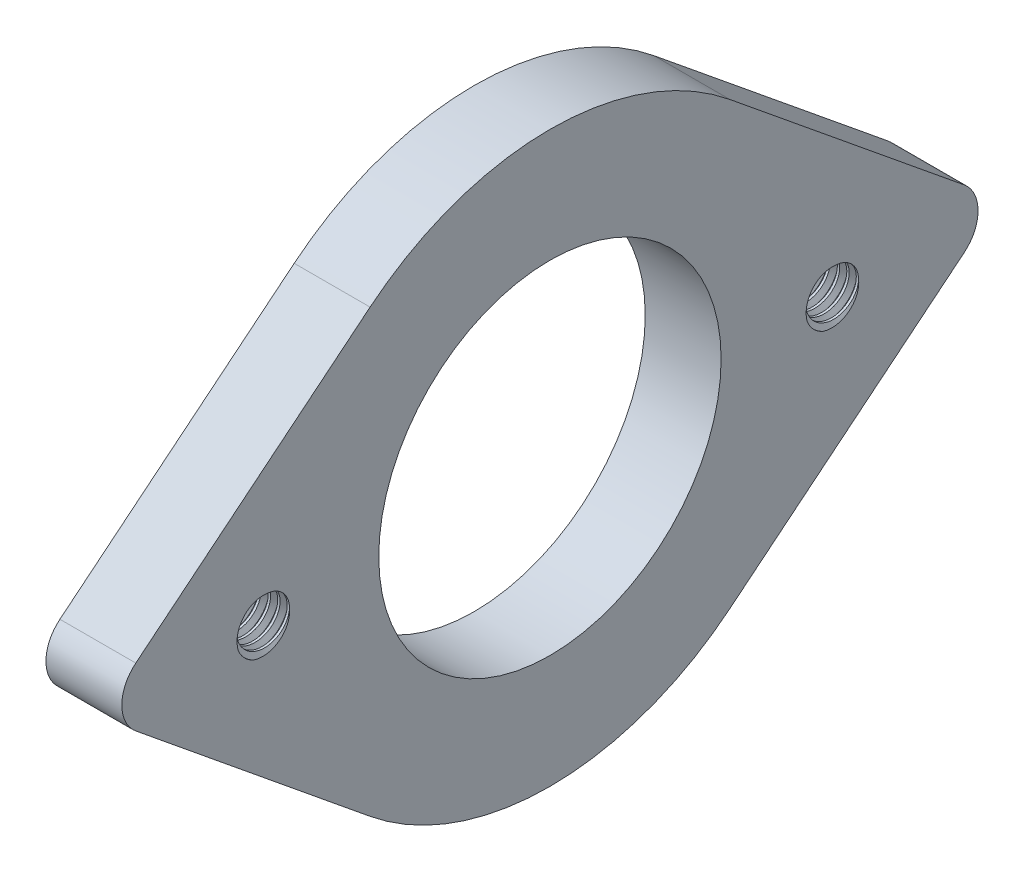
from build123d import *

# Parameters (mm, degrees)
CROQUIS1_W              = 25.4
CROQUIS1_H              = 50.8
CROQUIS1_W_2            = 22.225
CROQUIS1_H_2            = 47.625
SALIENTE_EXTRUIR1_DEPTH = 203.2
CROQUIS2_R              = 19.1135
CROQUIS2_R_2            = 2.4892
CORTAR_EXTRUIR1_DEPTH   = 207.350575478
CROQUIS3_R              = 2.0193
CROQUIS3_R_2            = 14.3256
SALIENTE_EXTRUIR2_DEPTH = 6.35
ROSCA1_PITCH            = 0.79375
ROSCA2_PITCH            = 0.79375


with BuildPart() as part:
    # Croquis1 → Saliente-Extruir1 (new, symmetric)
    with BuildSketch(Plane.XY):
        Rectangle(CROQUIS1_W, CROQUIS1_H)
        Rectangle(CROQUIS1_W_2, CROQUIS1_H_2, mode=Mode.SUBTRACT)
    extrude(amount=SALIENTE_EXTRUIR1_DEPTH, both=True)

    # Croquis2 → Cortar-Extruir1 (cut, through all)
    with BuildSketch(Plane.ZY.offset(12.7)):
        with Locations((-152.4, 0)):
            Circle(CROQUIS2_R)
        with Locations((-176.2125, 0)):
            Circle(CROQUIS2_R_2)
        with Locations((-128.5875, 0)):
            Circle(CROQUIS2_R_2)
        with Locations((91.782409489, 1.651)):
            Circle(CROQUIS2_R_2)
        with Locations((139.407409489, 1.651)):
            Circle(CROQUIS2_R_2)
        with BuildLine():
            Line((104.482409489, -15.8115), (126.707409489, -15.8115))
            ThreePointArc((126.707409489, -15.8115), (131.19753755, -13.951628061), (133.057409489, -9.4615))
            Line((133.057409489, -9.4615), (133.057409489, 12.7635))
            ThreePointArc((133.057409489, 12.7635), (131.19753755, 17.253628061), (126.707409489, 19.1135))
            Line((126.707409489, 19.1135), (104.482409489, 19.1135))
            ThreePointArc((104.482409489, 19.1135), (99.992281428, 17.253628061), (98.132409489, 12.7635))
            Line((98.132409489, 12.7635), (98.132409489, -9.4615))
            ThreePointArc((98.132409489, -9.4615), (99.992281428, -13.951628061), (104.482409489, -15.8115))
        make_face()
    extrude(amount=-CORTAR_EXTRUIR1_DEPTH, mode=Mode.SUBTRACT)


with BuildPart() as body_2:
    # Croquis3 → Saliente-Extruir2 (new body)
    with BuildSketch(Plane.ZY.offset(12.7)):
        with BuildLine():
            ThreePointArc((-187.058458071, 2.460395709), (-188.2267, 0), (-187.058458071, -2.460395709))
            Line((-187.058458071, -2.460395709), (-167.450685531, -18.452967818))
            ThreePointArc((-167.450685531, -18.452967818), (-152.4, -23.8125), (-137.349314469, -18.452967818))
            Line((-137.349314469, -18.452967818), (-117.741541929, -2.460395709))
            ThreePointArc((-117.741541929, -2.460395709), (-116.5733, 0), (-117.741541929, 2.460395709))
            Line((-117.741541929, 2.460395709), (-137.349314469, 18.452967818))
            ThreePointArc((-137.349314469, 18.452967818), (-152.4, 23.8125), (-167.450685531, 18.452967818))
            Line((-167.450685531, 18.452967818), (-187.058458071, 2.460395709))
        make_face()
        with Locations((-128.5875, 0)):
            Circle(CROQUIS3_R, mode=Mode.SUBTRACT)
        with Locations((-176.2125, 0)):
            Circle(CROQUIS3_R, mode=Mode.SUBTRACT)
        with Locations((-152.4, 0)):
            Circle(CROQUIS3_R_2, mode=Mode.SUBTRACT)
    extrude(amount=SALIENTE_EXTRUIR2_DEPTH)

    # Rosca1: the profile of Perfil de rosca1 profile screwed along a right-hand helix of 8 turns, 8 arcs to a turn; built about Z, then put on its axis
    rosca1_z = Axis((0, 0, 0), (0, 0, 1))
    rosca1_corners = [(2.019, 0, -0.000173205), (2.448929788, 0, 0.248046874), (2.448929788, 0, 0.347265624), (2.019, 0, 0.595485703)]
    with BuildLine(mode=Mode.PRIVATE) as rosca1_profile:
        Line(rosca1_corners[0], rosca1_corners[1])
        Line(rosca1_corners[1], rosca1_corners[2])
        Line(rosca1_corners[2], rosca1_corners[3])
        Line(rosca1_corners[3], rosca1_corners[0])
    rosca1_cap = Face(rosca1_profile.wire())
    rosca1_turn_angles = [0, 22.5, 45, 67.5, 90, 112.5, 135, 157.5, 180, 202.5, 225, 247.5, 270, 292.5, 315, 337.5, 360]
    rosca1_turn_weights = [1, 0.9238795325112867, 1, 0.9238795325112867, 1, 0.9238795325112867, 1, 0.9238795325112867, 1, 0.9238795325112867, 1, 0.9238795325112867, 1, 0.9238795325112867, 1, 0.9238795325112867, 1]
    rosca1_turn_rails = [Edge.make_bspline([Vector(p[0], p[1], 0).rotate(rosca1_z, rosca1_turn_angles[k]) / rosca1_turn_weights[k] + Vector(0, 0, p[2] + ROSCA1_PITCH * rosca1_turn_angles[k] / 360) for k in range(17)], [0, 0, 0, 1, 1, 2, 2, 3, 3, 4, 4, 5, 5, 6, 6, 7, 7, 8, 8, 8], 2, rosca1_turn_weights) for p in rosca1_corners]
    rosca1_turn_sides = [Face.make_surface_from_curves(rosca1_turn_rails[p[0]], rosca1_turn_rails[p[1]]) for p in [(0, 1), (1, 2), (2, 3), (3, 0)]]
    rosca1 = Plane(origin=(-19.05, 0, -128.5875), x_dir=(0, 0, -1), z_dir=(1, 0, 0)) * Solid(Shell([*[p.moved(Location((0, 0, ROSCA1_PITCH * i))) for i in range(8) for p in rosca1_turn_sides], rosca1_cap, rosca1_cap.rotate(rosca1_z, 2880).moved(Location((0, 0, ROSCA1_PITCH * 2880 / 360)))]))
    add(rosca1, mode=Mode.SUBTRACT)

    # Rosca2: the profile of Perfil de rosca2 profile screwed along a right-hand helix of 8 turns, 8 arcs to a turn; built about Z, then put on its axis
    rosca2_z = Axis((0, 0, 0), (0, 0, 1))
    rosca2_corners = [(2.019, 0, -0.000173205), (2.448929788, 0, 0.248046874), (2.448929788, 0, 0.347265624), (2.019, 0, 0.595485703)]
    with BuildLine(mode=Mode.PRIVATE) as rosca2_profile:
        Line(rosca2_corners[0], rosca2_corners[1])
        Line(rosca2_corners[1], rosca2_corners[2])
        Line(rosca2_corners[2], rosca2_corners[3])
        Line(rosca2_corners[3], rosca2_corners[0])
    rosca2_cap = Face(rosca2_profile.wire())
    rosca2_turn_angles = [0, 22.5, 45, 67.5, 90, 112.5, 135, 157.5, 180, 202.5, 225, 247.5, 270, 292.5, 315, 337.5, 360]
    rosca2_turn_weights = [1, 0.9238795325112867, 1, 0.9238795325112867, 1, 0.9238795325112867, 1, 0.9238795325112867, 1, 0.9238795325112867, 1, 0.9238795325112867, 1, 0.9238795325112867, 1, 0.9238795325112867, 1]
    rosca2_turn_rails = [Edge.make_bspline([Vector(p[0], p[1], 0).rotate(rosca2_z, rosca2_turn_angles[k]) / rosca2_turn_weights[k] + Vector(0, 0, p[2] + ROSCA2_PITCH * rosca2_turn_angles[k] / 360) for k in range(17)], [0, 0, 0, 1, 1, 2, 2, 3, 3, 4, 4, 5, 5, 6, 6, 7, 7, 8, 8, 8], 2, rosca2_turn_weights) for p in rosca2_corners]
    rosca2_turn_sides = [Face.make_surface_from_curves(rosca2_turn_rails[p[0]], rosca2_turn_rails[p[1]]) for p in [(0, 1), (1, 2), (2, 3), (3, 0)]]
    rosca2 = Plane(origin=(-19.05, 0, -176.2125), x_dir=(0, 0, -1), z_dir=(1, 0, 0)) * Solid(Shell([*[p.moved(Location((0, 0, ROSCA2_PITCH * i))) for i in range(8) for p in rosca2_turn_sides], rosca2_cap, rosca2_cap.rotate(rosca2_z, 2880).moved(Location((0, 0, ROSCA2_PITCH * 2880 / 360)))]))
    add(rosca2, mode=Mode.SUBTRACT)


solid = body_2.part
